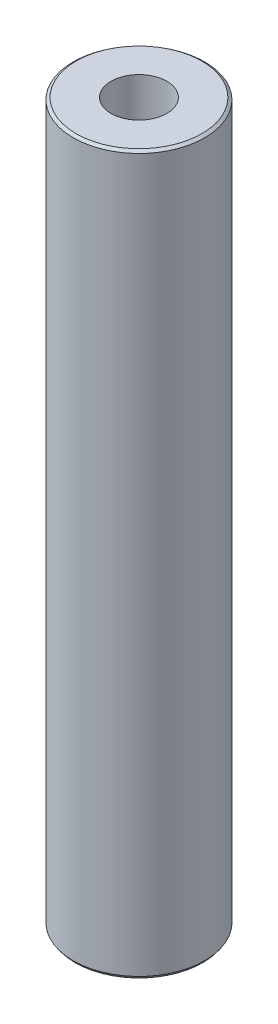
from build123d import *
from OCP.BRepFilletAPI import BRepFilletAPI_MakeChamfer

# Parameters (mm, degrees)
SKETCH1_R           = 55
BOSS_EXTRUDE1_DEPTH = 600
SKETCH2_R           = 23.332946493
CUT_EXTRUDE1_DEPTH  = 606.020660804
CHAMFER1_SIZE       = 1.761126483
CHAMFER1_SIZE2      = 2.402301756


with BuildPart() as part:
    # Sketch1 → Boss-Extrude1 (new body)
    with BuildSketch(Plane(origin=(0, 0, 0), x_dir=(1, 0, 0), z_dir=(0, 1, 0))):
        Circle(SKETCH1_R)
    extrude(amount=BOSS_EXTRUDE1_DEPTH)

    # Sketch2 → Cut-Extrude1 (cut, through all)
    with BuildSketch(Plane(origin=(0, 0, 0), x_dir=(1, 0, 0), z_dir=(0, 1, 0))):
        Circle(SKETCH2_R)
    extrude(amount=CUT_EXTRUDE1_DEPTH, mode=Mode.SUBTRACT)

    # Chamfer1: one chamfer whose edges measure the first distance from different faces: ONE call of the kernel's chamfer builder (chamfer() names one face for all edges)
    chamfer1_edges_1 = [part.edges().sort_by_distance(p)[0] for p in [
        (-55, 600, 0),
    ]]
    chamfer1_side_1 = [part.faces().sort_by_distance(p)[0] for p in [
        (-55, 300, 0),
    ]]
    chamfer1_edges_2 = [part.edges().sort_by_distance(p)[0] for p in [
        (-55, 0, 0),
    ]]
    chamfer1_side_2 = [part.faces().sort_by_distance(p)[0] for p in [
        (-53.444365081, 0, 0),
    ]]
    chamfer1 = BRepFilletAPI_MakeChamfer(part.part.solid().wrapped)
    for e in chamfer1_edges_1:
        chamfer1.Add(CHAMFER1_SIZE, CHAMFER1_SIZE2, e.wrapped, chamfer1_side_1[0].wrapped)  # the first distance lies on this face
    for e in chamfer1_edges_2:
        chamfer1.Add(CHAMFER1_SIZE, CHAMFER1_SIZE2, e.wrapped, chamfer1_side_2[0].wrapped)  # the first distance lies on this face
    add(Compound.cast(chamfer1.Shape()), mode=Mode.REPLACE)


solid = part.part
